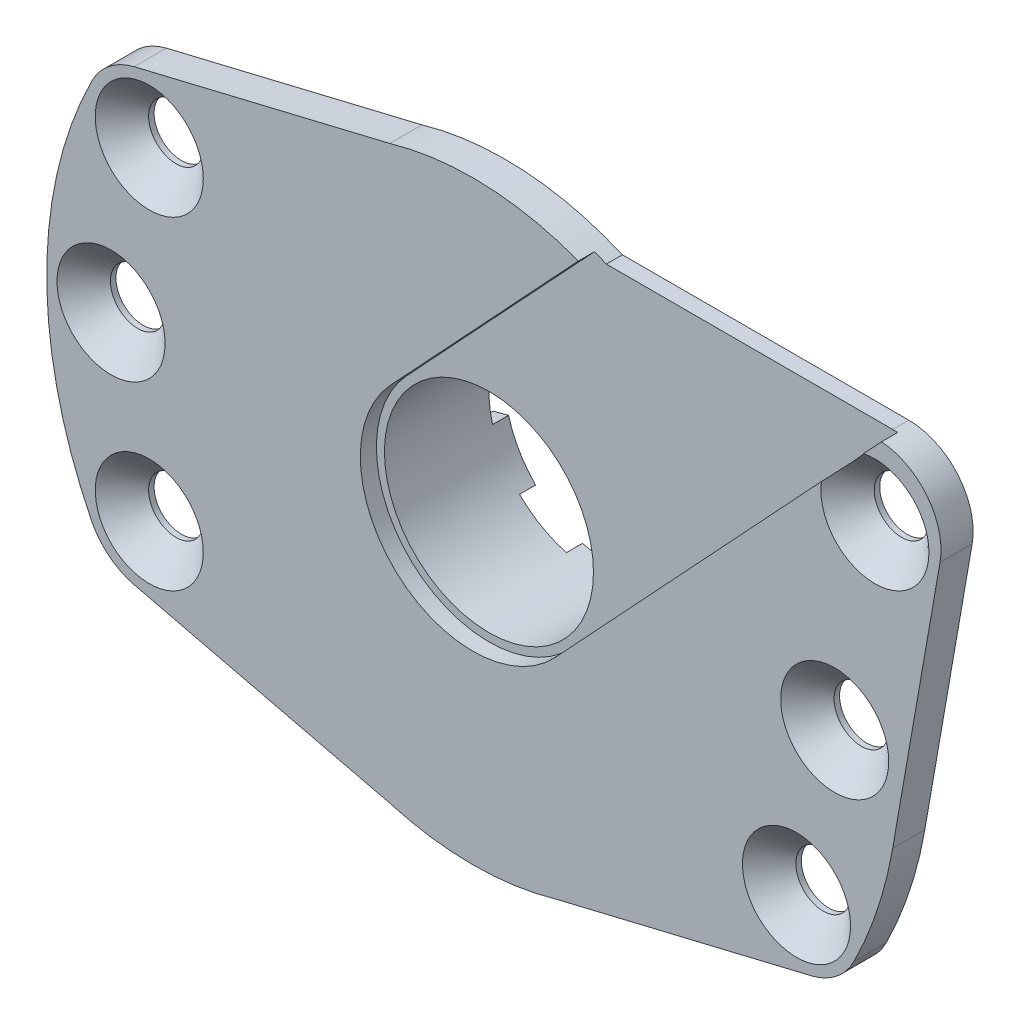
from build123d import *
from build123d.topology import SkipClean

# Parameters (mm, degrees)
SKETCH_1_R                 = 0.5
SKETCH_1_R_2               = 6.5
EXTRUDE_2_DEPTH            = 2
HOLE_WIZARD_M31_AT_2_COUNT = 2
HOLE_WIZARD_M31_AT_2_PITCH = 10.338881425
HOLE_WIZARD_M31_AT_3_COUNT = 2
HOLE_WIZARD_M31_AT_3_PITCH = 20.124611797
HOLE_WIZARD_M31_AT_4_COUNT = 2
HOLE_WIZARD_M31_AT_4_PITCH = 45
HOLE_WIZARD_M31_AT_5_COUNT = 2
HOLE_WIZARD_M31_AT_5_PITCH = 43.796204526
HOLE_WIZARD_M31_AT_6_COUNT = 2
HOLE_WIZARD_M31_AT_6_PITCH = 45.190407637
EXTRUDE_START              = 0.5
SKETCH_4_R                 = 8.5
SKETCH_4_R_2               = 6.5
EXTRUDE_3_DEPTH            = 0.5
EXTRUDE_START_2            = 5
SKETCH_5_R                 = 7.5
SKETCH_5_R_2               = 6.5
EXTRUDE_4_DEPTH            = 5
CUT_EXTRUDE_1_DEPTH        = 1
EXTRUDE_START_3            = 1
EXTRUDE_5_DEPTH            = 1


with BuildPart() as part:
    # Эскиз1 → Бобышка-Вытянуть2 (new body)
    with BuildSketch(Plane.XY):
        with BuildLine():
            Line((-5.16821295, 17.764543293), (-21.057898637, 13.951904294))
            ThreePointArc((-21.057898637, 13.951904294), (-22.612693727, 13.19430978), (-23.702320561, 11.851160281))
            ThreePointArc((-23.702320561, 11.851160281), (-26.5, 0), (-23.702320561, -11.851160281))
            ThreePointArc((-23.702320561, -11.851160281), (-22.612693727, -13.19430978), (-21.057898637, -13.951904294))
            Line((-21.057898637, -13.951904294), (-5.16821295, -17.764543293))
            ThreePointArc((-5.16821295, -17.764543293), (0, -18.50106547), (5.16821295, -17.764543293))
            Line((5.16821295, -17.764543293), (21.057898637, -13.951904294))
            ThreePointArc((21.057898637, -13.951904294), (22.612693727, -13.19430978), (23.702320561, -11.851160281))
            ThreePointArc((23.702320561, -11.851160281), (25.169556704, -8.291164895), (26.105397143, -4.556121157))
            Line((26.105397143, -4.556121157), (29.049405058, 12.312283599))
            ThreePointArc((29.049405058, 12.312283599), (28.170900607, 15.573823459), (25.108967753, 17))
            Line((25.108967753, 17), (7.299960514, 17))
            ThreePointArc((7.299960514, 17), (1.132350887, 18.466380397), (-5.16821295, 17.764543293))
        make_face()
        with Locations((25, 12.5)):
            Circle(SKETCH_1_R, mode=Mode.SUBTRACT)
        with Locations((22.5, 0)):
            Circle(SKETCH_1_R, mode=Mode.SUBTRACT)
        with Locations((20.124611797, -10.062305899)):
            Circle(SKETCH_1_R, mode=Mode.SUBTRACT)
        with Locations((-20.124611797, -10.062305899)):
            Circle(SKETCH_1_R, mode=Mode.SUBTRACT)
        with Locations((-22.5, 0)):
            Circle(SKETCH_1_R, mode=Mode.SUBTRACT)
        with Locations((-20.124611797, 10.062305899)):
            Circle(SKETCH_1_R, mode=Mode.SUBTRACT)
        Circle(SKETCH_1_R_2, mode=Mode.SUBTRACT)
    extrude(amount=EXTRUDE_2_DEPTH)

    # Эскиз3 → Зенковка для винта с потайной головкой и внутренним шестигранником M31 (revolve, cut)
    with BuildSketch(Plane(origin=(-20.124611797, 10.062305899, 2), x_dir=(0, -1, 0), z_dir=(1, 0, 0))):
        Polygon((0, 0), (0, 2), (1.7, 2), (1.7, 1.66), (3.36, 0), align=None)
    hole_wizard_m31 = revolve(axis=Axis((-20.124611797, 10.062305899, 8.35), (0, 0, -1)), mode=Mode.SUBTRACT)

    # Зенковка для винта с потайной головкой и внутренним шестигранником M31 at 2: Зенковка для винта с потайной головкой и внутренним шестигранником M31 ×2
    with Locations(*[Vector(-0.2297529205473615, -0.9732489894677301, 0) * (i * HOLE_WIZARD_M31_AT_2_PITCH) for i in range(1, HOLE_WIZARD_M31_AT_2_COUNT)]):
        add(hole_wizard_m31, mode=Mode.SUBTRACT)

    # Зенковка для винта с потайной головкой и внутренним шестигранником M31 at 3: Зенковка для винта с потайной головкой и внутренним шестигранником M31 ×2
    with Locations(*[(0, -i * HOLE_WIZARD_M31_AT_3_PITCH, 0) for i in range(1, HOLE_WIZARD_M31_AT_3_COUNT)]):
        add(hole_wizard_m31, mode=Mode.SUBTRACT)

    # Зенковка для винта с потайной головкой и внутренним шестигранником M31 at 4: Зенковка для винта с потайной головкой и внутренним шестигранником M31 ×2
    with Locations(*[Vector(0.894427190999916, -0.4472135954999578, 0) * (i * HOLE_WIZARD_M31_AT_4_PITCH) for i in range(1, HOLE_WIZARD_M31_AT_4_COUNT)]):
        add(hole_wizard_m31, mode=Mode.SUBTRACT)

    # Зенковка для винта с потайной головкой и внутренним шестигранником M31 at 5: Зенковка для винта с потайной головкой и внутренним шестигранником M31 ×2
    with Locations(*[Vector(0.9732489894677302, -0.2297529205473611, 0) * (i * HOLE_WIZARD_M31_AT_5_PITCH) for i in range(1, HOLE_WIZARD_M31_AT_5_COUNT)]):
        add(hole_wizard_m31, mode=Mode.SUBTRACT)

    # Зенковка для винта с потайной головкой и внутренним шестигранником M31 at 6: Зенковка для винта с потайной головкой и внутренним шестигранником M31 ×2
    with Locations(*[Vector(0.9985440308456991, 0.0539427331753181, 0) * (i * HOLE_WIZARD_M31_AT_6_PITCH) for i in range(1, HOLE_WIZARD_M31_AT_6_COUNT)]):
        add(hole_wizard_m31, mode=Mode.SUBTRACT)

    # Эскиз4 → Бобышка-Вытянуть3 (add)
    with SkipClean():  # the faces are left unmerged after this step: merging them gives an invalid solid
        with BuildSketch(Plane(origin=(0, 0, 0), x_dir=(-1, 0, 0), z_dir=(0, 0, -1)).offset(EXTRUDE_START)):
            Circle(SKETCH_4_R)
            Circle(SKETCH_4_R_2, mode=Mode.SUBTRACT)
        extrude(amount=-EXTRUDE_3_DEPTH)

    # Эскиз5 → Бобышка-Вытянуть4 (add)
    with SkipClean():  # the faces are left unmerged after this step: merging them gives an invalid solid
        with BuildSketch(Plane(origin=(0, 0, -0.5), x_dir=(-1, 0, 0), z_dir=(0, 0, -1)).offset(EXTRUDE_START_2)):
            Circle(SKETCH_5_R)
            Circle(SKETCH_5_R_2, mode=Mode.SUBTRACT)
        extrude(amount=-EXTRUDE_4_DEPTH)

    # Эскиз6 → Вырез-Вытянуть1 (cut)
    with SkipClean():  # the faces are left unmerged after this step: merging them gives an invalid solid
        with BuildSketch(Plane.XY.offset(2)):
            with BuildLine():
                Line((-5.119475911, 4.77398852), (15.340474891, 26.714599569))
                Line((15.340474891, 26.714599569), (25.579426713, 17.166622528))
                Line((25.579426713, 17.166622528), (5.119475911, -4.77398852))
                ThreePointArc((5.119475911, -4.77398852), (-4.77398852, -5.119475911), (-5.119475911, 4.77398852))
            make_face()
        extrude(amount=-CUT_EXTRUDE_1_DEPTH, mode=Mode.SUBTRACT)

    # Эскиз7 → Бобышка-Вытянуть5 (add)
    with SkipClean():  # the faces are left unmerged after this step: merging them gives an invalid solid
        with BuildSketch(Plane(origin=(0, 0, -5.5), x_dir=(-1, 0, 0), z_dir=(0, 0, -1)).offset(EXTRUDE_START_3)):
            with BuildLine():
                Line((-1.941142838, 7.244443697), (-1.682323793, 6.278517871))
                ThreePointArc((-1.682323793, 6.278517871), (0, 6.5), (1.682323793, 6.278517871))
                Line((1.682323793, 6.278517871), (1.941142838, 7.244443697))
                ThreePointArc((1.941142838, 7.244443697), (0, 7.5), (-1.941142838, 7.244443697))
            make_face()
            with BuildLine():
                Line((5.303300859, 5.303300859), (4.596194078, 4.596194078))
                ThreePointArc((4.596194078, 4.596194078), (5.629165125, 3.25), (6.278517871, 1.682323793))
                Line((6.278517871, 1.682323793), (7.244443697, 1.941142838))
                ThreePointArc((7.244443697, 1.941142838), (6.495190528, 3.75), (5.303300859, 5.303300859))
            make_face()
            with BuildLine():
                Line((7.244443697, -1.941142838), (6.278517871, -1.682323793))
                ThreePointArc((6.278517871, -1.682323793), (5.629165125, -3.25), (4.596194078, -4.596194078))
                Line((4.596194078, -4.596194078), (5.303300859, -5.303300859))
                ThreePointArc((5.303300859, -5.303300859), (6.495190528, -3.75), (7.244443697, -1.941142838))
            make_face()
            with BuildLine():
                Line((1.941142838, -7.244443697), (1.682323793, -6.278517871))
                ThreePointArc((1.682323793, -6.278517871), (0, -6.5), (-1.682323793, -6.278517871))
                Line((-1.682323793, -6.278517871), (-1.941142838, -7.244443697))
                ThreePointArc((-1.941142838, -7.244443697), (0, -7.5), (1.941142838, -7.244443697))
            make_face()
            with BuildLine():
                Line((-5.303300859, -5.303300859), (-4.596194078, -4.596194078))
                ThreePointArc((-4.596194078, -4.596194078), (-5.629165125, -3.25), (-6.278517871, -1.682323793))
                Line((-6.278517871, -1.682323793), (-7.244443697, -1.941142838))
                ThreePointArc((-7.244443697, -1.941142838), (-6.495190528, -3.75), (-5.303300859, -5.303300859))
            make_face()
            with BuildLine():
                Line((-7.244443697, 1.941142838), (-6.278517871, 1.682323793))
                ThreePointArc((-6.278517871, 1.682323793), (-5.629165125, 3.25), (-4.596194078, 4.596194078))
                Line((-4.596194078, 4.596194078), (-5.303300859, 5.303300859))
                ThreePointArc((-5.303300859, 5.303300859), (-6.495190528, 3.75), (-7.244443697, 1.941142838))
            make_face()
        extrude(amount=-EXTRUDE_5_DEPTH)


solid = part.part
